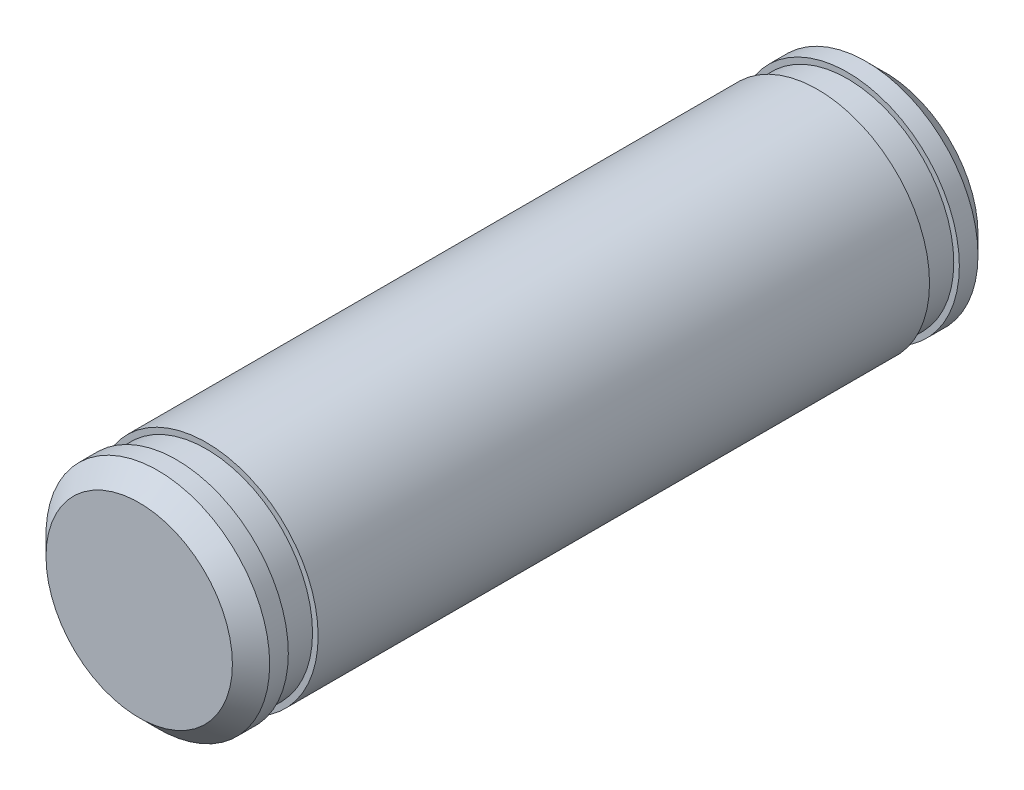
from build123d import *

# Parameters (mm, degrees)
SZKIC1_R                    = 3
DODANIE_WYCI_GNI_CIE1_DEPTH = 20
WYTNIJ_WYCI_GNI_CIE1_START  = -1.8
SZKIC2_R                    = 3
SZKIC2_R_2                  = 2.85
WYTNIJ_WYCI_GNI_CIE1_DEPTH  = 0.8
WYTNIJ_WYCI_GNI_CIE2_START  = -19
SZKIC2_2_R                  = 3
SZKIC2_2_R_2                = 2.85
WYTNIJ_WYCI_GNI_CIE2_DEPTH  = 0.8
SFAZOWANIE1_SIZE            = 0.5


with BuildPart() as part:
    # Szkic1 → Dodanie-wyciągnięcie1 (new body)
    with BuildSketch(Plane.XY):
        Circle(SZKIC1_R)
    extrude(amount=DODANIE_WYCI_GNI_CIE1_DEPTH)

    # Szkic2 → Wytnij-wyciągnięcie1 (cut)
    with BuildSketch(Plane.XY.offset(20).offset(WYTNIJ_WYCI_GNI_CIE1_START)):
        Circle(SZKIC2_R)
        Circle(SZKIC2_R_2, mode=Mode.SUBTRACT)
    extrude(amount=WYTNIJ_WYCI_GNI_CIE1_DEPTH, mode=Mode.SUBTRACT)

    # Szkic2<2> → Wytnij-wyciągnięcie2 (cut)
    with BuildSketch(Plane.XY.offset(20).offset(WYTNIJ_WYCI_GNI_CIE2_START)):
        Circle(SZKIC2_2_R)
        Circle(SZKIC2_2_R_2, mode=Mode.SUBTRACT)
    extrude(amount=WYTNIJ_WYCI_GNI_CIE2_DEPTH, mode=Mode.SUBTRACT)

    # Sfazowanie1
    sfazowanie1_edges = [part.edges().sort_by_distance(p)[0] for p in [
        (-3, 0, 0),
        (-3, 0, 20),
    ]]
    chamfer(sfazowanie1_edges, length=SFAZOWANIE1_SIZE)


solid = part.part
